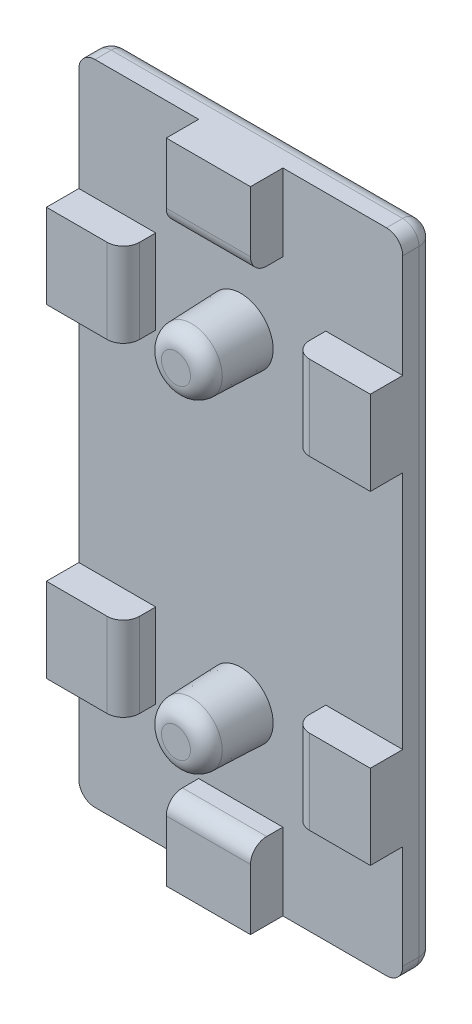
from build123d import *

# Parameters (mm, degrees)
BOSS_EXTRUDE1_DEPTH           = 2
SKETCH2_R                     = 2
BOSS_EXTRUDE2_DEPTH           = 4
BOSS_EXTRUDE2_DRAFT           = 2
BOSS_EXTRUDE2_PROFILE_2_DEPTH = 4
BOSS_EXTRUDE2_PROFILE_2_DRAFT = 2
FILLET1_R                     = 1
SKETCH4_W                     = 5.2
SKETCH4_H                     = 4.75
SKETCH4_W_2                   = 4.75
SKETCH4_H_2                   = 5.2
BOSS_EXTRUDE3_DEPTH           = 2
FILLET2_R                     = 1
CUT_EXTRUDE1_DEPTH            = 0.5


with BuildPart() as part:
    # Sketch1 → Boss-Extrude1 (new body)
    with BuildSketch(Plane.XY):
        with BuildLine():
            Line((1, 0), (19, 0))
            ThreePointArc((19, 0), (19.707106781, 0.292893219), (20, 1))
            Line((20, 1), (20, 39))
            ThreePointArc((20, 39), (19.707106781, 39.707106781), (19, 40))
            Line((19, 40), (1, 40))
            ThreePointArc((1, 40), (0.292893219, 39.707106781), (0, 39))
            Line((0, 39), (0, 1))
            ThreePointArc((0, 1), (0.292893219, 0.292893219), (1, 0))
        make_face()
    extrude(amount=BOSS_EXTRUDE1_DEPTH)


with BuildPart() as boss_extrude2_tool:
    # Sketch2 → Boss-Extrude2 (with draft: the straight prism first)
    with BuildSketch(Plane.XY.offset(2)):
        with Locations((10, 30)):
            Circle(SKETCH2_R)
    extrude(amount=BOSS_EXTRUDE2_DEPTH)
    # Boss-Extrude2: the draft: its side faces are tilted about the plane it starts from
    boss_extrude2_sides = [boss_extrude2_tool.faces().sort_by_distance(p)[0] for p in [
        (8, 30, 4),
    ]]
    draft(boss_extrude2_sides, Plane.XY.offset(2), BOSS_EXTRUDE2_DRAFT)


with BuildPart() as part_1:
    add(part.part)

    # Boss-Extrude2: add boss_extrude2_tool
    add(boss_extrude2_tool.part)


with BuildPart() as boss_extrude2_profile_2_tool:
    # Sketch2 → Boss-Extrude2 profile 2 (with draft: the straight prism first)
    with BuildSketch(Plane.XY.offset(2)):
        with Locations((10, 10)):
            Circle(SKETCH2_R)
    extrude(amount=BOSS_EXTRUDE2_PROFILE_2_DEPTH)
    # Boss-Extrude2 profile 2: the draft: its side faces are tilted about the plane it starts from
    boss_extrude2_profile_2_sides = [boss_extrude2_profile_2_tool.faces().sort_by_distance(p)[0] for p in [
        (8, 10, 4),
    ]]
    draft(boss_extrude2_profile_2_sides, Plane.XY.offset(2), BOSS_EXTRUDE2_PROFILE_2_DRAFT)


with BuildPart() as part_2:
    add(part_1.part)

    # Boss-Extrude2 profile 2: add boss_extrude2_profile_2_tool
    add(boss_extrude2_profile_2_tool.part)

    # Fillet1
    fillet1_edges = [part_2.edges().sort_by_distance(p)[0] for p in [
        (0, 20, 0),
        (0.292893219, 0.292893219, 0),
        (10, 0, 0),
        (19.707106781, 0.292893219, 0),
        (20, 20, 0),
        (19.707106781, 39.707106781, 0),
        (10, 40, 0),
        (0.292893219, 39.707106781, 0),
    ]]
    fillet(fillet1_edges, radius=FILLET1_R)

    # Sketch4 → Boss-Extrude3 (add)
    with BuildSketch(Plane.XY.offset(2)):
        with Locations((10, 37.625)):
            Rectangle(SKETCH4_W, SKETCH4_H)
        with Locations((10, 2.375)):
            Rectangle(SKETCH4_W, SKETCH4_H)
        with Locations((2.375, 30)):
            Rectangle(SKETCH4_W_2, SKETCH4_H_2)
        with Locations((2.375, 10)):
            Rectangle(SKETCH4_W_2, SKETCH4_H_2)
        with Locations((17.625, 30)):
            Rectangle(SKETCH4_W_2, SKETCH4_H_2)
        with Locations((17.625, 10)):
            Rectangle(SKETCH4_W_2, SKETCH4_H_2)
    extrude(amount=BOSS_EXTRUDE3_DEPTH)

    # Fillet2
    fillet2_edges = [part_2.edges().sort_by_distance(p)[0] for p in [
        (8.139683078, 30, 6),
        (8.139683078, 10, 6),
        (4.75, 10, 4),
        (10, 4.75, 4),
        (15.25, 10, 4),
        (15.25, 30, 4),
        (4.75, 30, 4),
        (10, 35.25, 4),
    ]]
    fillet(fillet2_edges, radius=FILLET2_R)

    # Sketch5 → Cut-Extrude1 (cut)
    with BuildSketch(Plane(origin=(0, 0, 0), x_dir=(-1, 0, 0), z_dir=(0, 0, -1))):
        Polygon((-14.786375934, 26.416896591), (-14.852212264, 26.43608174), (-14.835416922, 26.387134756), (-14.81677481, 26.339312998), (-14.796368621, 26.292573894), (-14.774281044, 26.246874873), (-14.750594771, 26.202173364), (-14.725392493, 26.158426794), (-14.6987569, 26.115592592), (-14.670770685, 26.073628187), (-14.641516537, 26.032491007), (-14.611077148, 25.99213848), (-14.579535208, 25.952528035), (-14.546973409, 25.9136171), (-14.513474442, 25.875363103), (-14.443995766, 25.800655639), (-14.334816263, 25.692457193), (-13.917511895, 25.317904382), (-14.005691589, 25.326423318), (-15.185124895, 25.515380005), (-15.229534014, 25.522117017), (-15.273534328, 25.530103191), (-15.317148794, 25.53926829), (-15.360400375, 25.54954208), (-15.445906718, 25.573134784), (-15.53023704, 25.600319416), (-15.654929288, 25.646602098), (-16.225519503, 25.897011062), (-16.390910681, 25.961270725), (-16.383415093, 25.918750858), (-16.373803927, 25.877329485), (-16.362178867, 25.836959918), (-16.348641598, 25.797595475), (-16.333293806, 25.759189469), (-16.316237175, 25.721695216), (-16.29757339, 25.685066032), (-16.277404136, 25.649255231), (-16.255831097, 25.614216129), (-16.232955959, 25.579902041), (-16.208880407, 25.546266282), (-16.183706125, 25.513262168), (-16.130468112, 25.448962133), (-16.0740554, 25.386628457), (-15.954959793, 25.266366274), (-15.686170366, 25.003596246), (-15.804835087, 25.031112715), (-16.040022293, 25.093432663), (-16.272530603, 25.164546337), (-16.616735875, 25.285284081), (-17.346903311, 25.588419154), (-17.344227417, 25.563376726), (-17.336182106, 25.514090547), (-17.324752116, 25.465856921), (-17.310185468, 25.418661031), (-17.282996808, 25.349780541), (-17.250145785, 25.283151612), (-17.18508458, 25.176971046), (-17.013866926, 24.963759201), (-16.421290053, 24.423782306), (-16.173711279, 24.244778303), (-15.864867475, 24.00967072), (-16.823521028, 24.219040589), (-17.398932887, 24.329030602), (-17.369180143, 24.276096141), (-17.337169882, 24.225486904), (-17.303015586, 24.177094787), (-17.266830734, 24.130811686), (-17.22872881, 24.086529498), (-17.188823292, 24.04414012), (-17.147227663, 24.003535447), (-17.104055403, 23.964607376), (-17.059419993, 23.927247803), (-17.013434915, 23.891348625), (-16.966213649, 23.856801738), (-16.917869676, 23.823499038), (-16.868516478, 23.791332422), (-16.818267535, 23.760193786), (-16.715536339, 23.70056804), (-16.557558484, 23.61613668), (-16.135152364, 23.399750546), (-16.034211108, 23.342961375), (-16.466508413, 23.291816812), (-16.454116059, 23.272029843), (-16.427130404, 23.234708584), (-16.397423179, 23.200233756), (-16.365250018, 23.168416787), (-16.330866554, 23.139069105), (-16.275706236, 23.099264993), (-16.196808993, 23.053075344), (-15.921704512, 22.939917238), (-15.837164175, 22.9133984), (-14.671840338, 22.649352185), (-14.910820809, 22.491962149), (-14.786205542, 22.470076345), (-14.158616766, 22.36956409), (-14.035274304, 22.340228054), (-13.953991647, 22.317017751), (-13.873617499, 22.290341045), (-13.794282138, 22.259731611), (-13.755044714, 22.242806394), (-13.71611584, 22.224723123), (-13.814668902, 22.124427835), (-13.648340365, 21.958108028), (-13.557955427, 21.897539473), (-13.500873795, 21.872092305), (-13.455010521, 21.858483596), (-13.425285668, 21.851442055), (-13.33564708, 21.834430557), (-13.184988841, 21.817224724), (-12.57772723, 21.788033232), (-12.659581211, 21.642395891), (-12.598554021, 21.618620898), (-12.474487704, 21.578304767), (-12.348148972, 21.547122766), (-12.187779816, 21.520055946), (-11.993018707, 21.503463819), (-11.732131071, 21.504904317), (-11.702848155, 21.366572637), (-11.681471553, 21.333654593), (-11.662899468, 21.318327209), (-11.647630317, 21.310406831), (-11.629774573, 21.304579431), (-11.607820379, 21.2998022), (-11.564025098, 21.293505181), (-11.520394618, 21.291226011), (-11.47694573, 21.292574203), (-11.433695226, 21.297159272), (-11.347856533, 21.314478089), (-11.015795351, 21.435131057), (-11.096989439, 21.216822079), (-10.229734651, 21.22443732), (-10.196621528, 21.221909159), (-10.163889305, 21.21804126), (-10.131544618, 21.212872501), (-10.099594102, 21.206441763), (-10.068044393, 21.198787925), (-10.036902126, 21.189949868), (-10.006173935, 21.17996647), (-9.975866458, 21.168876611), (-9.945986328, 21.156719171), (-9.916540182, 21.143533031), (-9.858976381, 21.114230165), (-9.803228137, 21.081279051), (-9.749348533, 21.044990727), (-9.697390653, 21.00567623), (-9.647407579, 20.963646598), (-9.576251848, 20.896191666), (-9.509838021, 20.824377268), (-9.448345254, 20.749253156), (-9.7849395, 20.683389745), (-9.83662758, 20.691536463), (-9.887942595, 20.701093531), (-9.938913615, 20.711950064), (-9.989569705, 20.723995181), (-10.090053371, 20.751207638), (-10.239143603, 20.798168642), (-10.780956243, 20.987884448), (-10.880663913, 21.017649231), (-10.981321027, 21.04374129), (-11.032078295, 21.055132842), (-11.083160128, 21.065273566), (-11.134595594, 21.074052579), (-11.186413759, 21.081359), (-11.238643694, 21.087081946), (-11.281876726, 21.091739987), (-11.368640316, 21.098577593), (-11.455666469, 21.102074183), (-11.542794217, 21.102186096), (-11.629862593, 21.098869675), (-11.716710629, 21.09208126), (-11.803177358, 21.081777193), (-11.889101812, 21.067913816), (-11.974323024, 21.050447469), (-12.058680026, 21.029334494), (-12.142011852, 21.004531232), (-12.224157532, 20.975994024), (-12.304956101, 20.943679211), (-12.384246591, 20.907543136), (-12.461868033, 20.867542138), (-12.650636818, 20.763312648), (-12.775014555, 20.690342014), (-12.897845415, 20.61442474), (-13.018810218, 20.535424372), (-13.137589779, 20.453204459), (-13.253864916, 20.367628548), (-13.310963581, 20.323539451), (-13.367316447, 20.278560185), (-13.422883615, 20.232673693), (-13.477625189, 20.185862919), (-13.531501269, 20.138110805), (-13.584471959, 20.089400296), (-13.63649736, 20.039714334), (-13.687537575, 19.989035864), (-13.737552705, 19.937347828), (-13.786502854, 19.88463317), (-13.834348122, 19.830874833), (-13.881048613, 19.776055762), (-13.926564429, 19.720158898), (-13.97085567, 19.663167186), (-14.013882441, 19.605063569), (-14.055604843, 19.545830991), (-14.618491972, 18.746379801), (-14.650767235, 18.695863991), (-15.153578557, 18.064851802), (-15.270315213, 17.920493502), (-15.391602566, 17.78005973), (-15.559919206, 17.598774704), (-15.735177114, 17.424119053), (-15.916719795, 17.255894172), (-16.151485985, 17.054353774), (-16.443008391, 16.824812961), (-16.609162766, 16.70935822), (-16.69335871, 16.66982675), (-16.745092456, 16.657971431), (-16.786063295, 16.655908137), (-16.805355847, 16.655227135), (-16.824454753, 16.655850532), (-16.843375412, 16.657666984), (-16.880743585, 16.664433679), (-16.917583561, 16.674636471), (-17.116267103, 16.752366744), (-17.17102211, 16.767443867), (-17.208071471, 16.773068491), (-17.226806157, 16.774218735), (-17.245701377, 16.774112476), (-17.264772532, 16.772638369), (-17.284035021, 16.769685072), (-17.303504243, 16.765141241), (-17.323195596, 16.758895532), (-17.966720976, 16.53750061), (-17.938354194, 16.416303184), (-18.389091508, 16.241458445), (-18.258335094, 16.138921453), (-18.527851634, 15.896271822), (-18.403637422, 15.807976255), (-18.429306674, 15.747569562), (-18.5059163, 15.498088645), (-18.52895454, 15.325970977), (-18.528628345, 15.194542192), (-18.340186257, 15.188312191), (-18.078502884, 14.917009038), (-18.03256369, 15.016438826), (-17.945759666, 15.199522261), (-17.914499172, 15.242954263), (-17.890517881, 15.269089252), (-17.863556704, 15.292523265), (-17.84883354, 15.303108146), (-17.83321526, 15.312874671), (-17.816651817, 15.321775138), (-17.799093163, 15.329761843), (-17.78048925, 15.336787081), (-17.740155904, 15.152741364), (-17.680429464, 15.165407309), (-17.546720396, 15.210198843), (-17.215645511, 15.40245347), (-17.05579711, 15.348661974), (-16.96742528, 15.347427134), (-16.934123638, 15.362632172), (-16.856088118, 15.408336701), (-16.5664801, 15.681077699), (-16.549336963, 15.699999961), (-16.495280289, 15.7535217), (-16.39805408, 15.833932338), (-15.983227586, 16.124404438), (-15.913391732, 16.176455879), (-15.844521012, 16.229586052), (-15.776587247, 16.283757629), (-15.709562255, 16.338933282), (-15.643417857, 16.395075681), (-15.578125873, 16.452147497), (-15.513658123, 16.510111401), (-15.449986427, 16.568930064), (-15.387082605, 16.628566157), (-15.263465863, 16.750141318), (-15.142582456, 16.874538251), (-15.024206946, 17.001458324), (-14.908113891, 17.130602905), (-14.737760764, 17.327837473), (-14.2468625, 17.935461671), (-14.215860958, 17.967815456), (-14.15596508, 18.034116039), (-14.070660623, 18.13700296), (-13.911584289, 18.351539746), (-13.548065489, 18.858458829), (-13.4620669, 18.961115344), (-13.44038156, 18.592401345), (-13.450821534, 18.506161236), (-13.464151549, 18.455339861), (-13.548006597, 18.344819631), (-14.169071838, 17.596882239), (-14.30599478, 17.410563874), (-14.32901032, 17.373966582), (-14.34949161, 17.33681622), (-14.367561677, 17.299143708), (-14.383343552, 17.260979967), (-14.396960264, 17.222355919), (-14.408534841, 17.183302484), (-14.418190313, 17.143850585), (-14.42604971, 17.104031142), (-14.432236059, 17.063875076), (-14.43687239, 17.023413308), (-14.440081733, 16.98267676), (-14.441987117, 16.941696352), (-14.442378122, 16.859127644), (-14.436260661, 16.734218664), (-14.397752545, 16.318753495), (-14.39408807, 16.237681533), (-14.467654492, 15.430165405), (-14.480961291, 15.332688053), (-14.537131403, 14.964458593), (-14.538264604, 14.890812444), (-14.535249086, 14.841800705), (-14.52868465, 14.792881531), (-14.518115186, 14.744075499), (-14.511186033, 14.719721342), (-14.504752596, 14.701934172), (-14.497405782, 14.684949056), (-14.4891944, 14.668723694), (-14.470373166, 14.638383041), (-14.448679364, 14.610573825), (-14.424503462, 14.584957657), (-14.355766976, 14.528291157), (-14.132132176, 14.374968324), (-14.071136433, 14.326712136), (-13.868158368, 14.137114828), (-13.82041572, 14.104182572), (-13.78662374, 14.085845181), (-13.750927653, 14.071023193), (-13.732276301, 14.065096934), (-13.7130418, 14.060249276), (-13.693188442, 14.056546802), (-13.672680521, 14.054056097), (-13.630687622, 14.051013631), (-12.452535971, 14.051484245), (-12.423560421, 14.054107376), (-12.328371893, 14.083604899), (-12.28045521, 14.117523105), (-12.255923773, 14.147285485), (-12.242639104, 14.17349493), (-12.23454355, 14.203124862), (-12.219185718, 14.407286635), (-12.22564453, 14.475274868), (-12.236975279, 14.524168293), (-12.248224209, 14.555296665), (-12.262806419, 14.584959847), (-12.281045228, 14.612908069), (-12.291636895, 14.626161019), (-12.303263955, 14.638891566), (-12.315966823, 14.651068489), (-12.329785915, 14.662660567), (-12.351994379, 14.68356469), (-12.374942843, 14.703309465), (-12.398593505, 14.721902586), (-12.422908564, 14.739351746), (-12.447850219, 14.755664639), (-12.473380668, 14.770848957), (-12.49946211, 14.784912393), (-12.526056744, 14.797862641), (-12.553126768, 14.809707395), (-12.580634381, 14.820454346), (-12.608541781, 14.830111189), (-12.636811168, 14.838685617), (-12.665404739, 14.846185322), (-12.694284694, 14.852617998), (-12.723413232, 14.857991339), (-12.782264847, 14.865590785), (-12.841657176, 14.869045205), (-12.901287806, 14.868416147), (-12.960854328, 14.863765154), (-13.020054329, 14.855153773), (-13.078585401, 14.842643549), (-13.136145131, 14.826296027), (-13.338883815, 15.279869848), (-13.116777254, 15.603312268), (-13.012440579, 15.789936067), (-12.952451236, 15.918976981), (-12.913449652, 16.018388874), (-12.880220293, 16.120189971), (-12.861557547, 16.189444208), (-12.776069116, 16.509422708), (-12.277642578, 16.68740958), (-12.236730466, 16.702440396), (-12.109720937, 16.735038327), (-11.810052548, 16.799339049), (-11.749350293, 16.822614846), (-11.710237499, 16.84187952), (-11.672405497, 16.864697842), (-11.628971236, 16.903214198), (-11.527791053, 17.006352957), (-11.146905201, 17.516698241), (-11.027868075, 17.47295563), (-10.90351017, 17.405950912), (-10.855392469, 17.366751026), (-10.823393836, 17.33250925), (-10.795544081, 17.293561437), (-10.779568496, 17.264734709), (-10.904271706, 16.914550764), (-11.036469517, 16.489054362), (-11.067599965, 16.343781633), (-11.084615752, 16.233179814), (-11.091607962, 16.182356821), (-11.124673091, 15.891679629), (-11.124381874, 15.812446933), (-11.120131945, 15.760425337), (-11.111993614, 15.709320396), (-11.106293858, 15.684185733), (-11.099415073, 15.659369107), (-11.091288284, 15.634900143), (-11.081844514, 15.610808465), (-11.071014788, 15.587123698), (-11.058730129, 15.563875467), (-11.044921561, 15.541093395), (-11.02952011, 15.518807107), (-11.012456797, 15.497046228), (-10.985848794, 15.465085129), (-10.902859575, 15.372326922), (-10.75582039, 15.226363053), (-10.129661164, 14.681051152), (-9.801524549, 14.269600556), (-9.660155191, 14.127932334), (-9.553095197, 14.09887306), (-9.021546991, 14.045529414), (-8.718554814, 14.04419734), (-8.592566225, 14.057493488), (-8.518794606, 14.072534515), (-8.4707368, 14.086161678), (-8.423781621, 14.103036471), (-8.378103935, 14.123474138), (-8.333878604, 14.147789918), (-8.312365218, 14.161500615), (-8.296934255, 14.191909351), (-8.279143924, 14.23957503), (-8.267419533, 14.289173513), (-8.260520201, 14.357280296), (-8.262718243, 14.426348512), (-8.280964735, 14.528660192), (-8.321043103, 14.64036946), (-8.333540269, 14.654382886), (-8.346637372, 14.667344444), (-8.360302329, 14.679305274), (-8.38920747, 14.700429294), (-8.419999025, 14.718164048), (-8.452420324, 14.732918638), (-8.521125486, 14.755123729), (-8.809802303, 14.806557819), (-8.832462412, 14.808957167), (-8.854487959, 14.812580519), (-8.875912978, 14.817362098), (-8.896771505, 14.823236127), (-8.93692522, 14.83799842), (-8.975221383, 14.856341178), (-9.029778325, 14.889417579), (-9.230716195, 15.054923756), (-9.333676338, 15.132733247), (-9.519762754, 15.263866184), (-9.557467171, 15.304644522), (-9.58026234, 15.339213495), (-9.592257671, 15.364508723), (-9.601324464, 15.391822073), (-9.607147824, 15.421341024), (-9.616309124, 15.452504527), (-9.623939111, 15.483669413), (-9.630106524, 15.514832695), (-9.634880105, 15.545991382), (-9.638328594, 15.577142487), (-9.640520733, 15.60828302), (-9.641525261, 15.639409992), (-9.641410919, 15.670520414), (-9.63810059, 15.732679652), (-9.63113967, 15.794736824), (-9.615056395, 15.887578897), (-9.502290589, 16.314722772), (-9.488323957, 16.359286779), (-9.470997534, 16.401978446), (-9.439723625, 16.463078946), (-9.363896313, 16.577951867), (-9.191408405, 16.823010954), (-9.160222242, 16.884587442), (-9.020499232, 17.188291873), (-8.960661748, 17.175222727), (-8.755913679, 17.114809173), (-8.179281464, 16.914540756), (-8.03195595, 16.867283457), (-7.885622862, 16.807651462), (-7.816155286, 16.771146154), (-7.772117135, 16.743775295), (-7.73035784, 16.713693956), (-7.69127169, 16.680659317), (-7.672854259, 16.662958628), (-7.655252972, 16.644428556), (-7.638517116, 16.625038749), (-7.622695976, 16.604758853), (-7.607838839, 16.583558517), (-7.59399499, 16.561407387), (-7.581213716, 16.538275112), (-7.569544302, 16.514131338), (-7.559955101, 16.482879891), (-7.551850332, 16.45147708), (-7.545125524, 16.419933167), (-7.539676204, 16.38825841), (-7.535397903, 16.356463072), (-7.529936466, 16.292551691), (-7.527915154, 16.196036763), (-7.540954676, 15.839710975), (-7.537656339, 15.743087371), (-7.531039499, 15.679077663), (-7.52609228, 15.647225399), (-7.519913233, 15.615488542), (-7.512397885, 15.583877352), (-7.497193243, 15.54259421), (-7.459762372, 15.463887827), (-7.244200498, 15.134938406), (-7.193092962, 15.038325511), (-7.172789572, 14.999831567), (-7.155905642, 14.960187389), (-7.130123748, 14.878218993), (-7.064088946, 14.583419077), (-7.042160822, 14.522945576), (-7.023768271, 14.483921545), (-7.001693892, 14.446155599), (-6.97412988, 14.405632487), (-6.672340973, 14.108695113), (-6.645772156, 14.090650861), (-6.618136984, 14.07614187), (-6.5749545, 14.060206473), (-6.514796293, 14.047917117), (-6.233001805, 14.043826419), (-6.207073506, 14.044850989), (-5.659119359, 14.047443972), (-5.556164289, 14.060851953), (-5.479735445, 14.077466765), (-5.456938455, 14.091929626), (-5.436093883, 14.108054931), (-5.417179592, 14.125712629), (-5.400173446, 14.144772671), (-5.38505331, 14.165105006), (-5.371797047, 14.186579584), (-5.36038252, 14.209066354), (-5.350787594, 14.232435267), (-5.342990133, 14.256556272), (-5.336968, 14.281299319), (-5.332699059, 14.306534358), (-5.330161174, 14.332131338), (-5.329332209, 14.35796021), (-5.330190027, 14.383890922), (-5.332712492, 14.409793426), (-5.336877469, 14.435537669), (-5.34266282, 14.460993603), (-5.350046411, 14.486031177), (-5.359006104, 14.510520341), (-5.369519763, 14.534331044), (-5.381565253, 14.557333236), (-5.395120437, 14.579396868), (-5.410163178, 14.600391888), (-5.426671341, 14.620188247), (-5.44462279, 14.638655894), (-5.463995388, 14.655664779), (-5.484766999, 14.671084852), (-5.506915487, 14.684786062), (-5.530418716, 14.69663836), (-5.579209828, 14.711326602), (-5.629052733, 14.722719883), (-5.937437486, 14.761178296), (-6.038316949, 14.779446627), (-6.087372148, 14.792759919), (-6.135200508, 14.809794843), (-6.158583416, 14.819927185), (-6.181574165, 14.831253056), (-6.204144273, 14.843860165), (-6.226265257, 14.857836219), (-6.247908633, 14.873268924), (-6.255725448, 14.910650942), (-6.263581668, 14.985233979), (-6.260841516, 15.077977736), (-6.181086324, 15.404103481), (-6.173515112, 15.431045166), (-6.167270995, 15.458003185), (-6.162277726, 15.484976691), (-6.158459054, 15.511964834), (-6.155738733, 15.538966766), (-6.153288144, 15.593008606), (-6.154315969, 15.647095422), (-6.161045382, 15.728295133), (-6.217294325, 16.107690254), (-6.221709324, 16.188944233), (-6.238563482, 16.859035178), (-5.943219192, 16.985086587), (-5.914435836, 16.896206825), (-5.882291807, 16.808791308), (-5.847033051, 16.722759062), (-5.788842814, 16.596127197), (-5.725027895, 16.472152216), (-5.632626521, 16.31051283), (-5.297234892, 15.806621023), (-5.061937323, 15.473564339), (-4.977413401, 15.321088423), (-4.930823319, 15.21477947), (-4.902232808, 15.132200428), (-4.886602245, 15.075659435), (-4.803728629, 14.663512644), (-4.770871666, 14.569560914), (-4.744242059, 14.515400485), (-4.420527886, 14.260875056), (-4.242891254, 14.118155761), (-4.184642094, 14.088000574), (-4.14690022, 14.076539884), (-4.120328377, 14.072338479), (-4.092489683, 14.071266625), (-3.418989386, 14.07270593), (-3.392617373, 14.074247492), (-3.366589031, 14.07804588), (-3.340995543, 14.083989488), (-3.315928088, 14.09196671), (-3.291477849, 14.10186594), (-3.267736007, 14.113575574), (-3.244793743, 14.126984005), (-3.222742238, 14.141979628), (-3.201672673, 14.158450837), (-3.18167623, 14.176286026), (-3.16284409, 14.19537359), (-3.145267434, 14.215601924), (-3.129037443, 14.236859421), (-3.114245298, 14.259034476), (-3.100982181, 14.282015484), (-3.089339274, 14.305690838), (-3.079407756, 14.329948933), (-3.07127881, 14.354678163), (-3.065043617, 14.379766924), (-3.060793357, 14.405103608), (-3.058619213, 14.430576611), (-3.058612365, 14.456074327), (-3.060863995, 14.48148515), (-3.065465283, 14.506697475), (-3.072507412, 14.531599695), (-3.082081562, 14.556080206), (-3.094278914, 14.580027402), (-3.10919065, 14.603329677), (-3.126907951, 14.625875425), (-3.144074214, 14.648005155), (-3.162261787, 14.668058359), (-3.181412041, 14.686149669), (-3.20146635, 14.702393717), (-3.222366087, 14.716905137), (-3.244052624, 14.729798561), (-3.266467335, 14.741188621), (-3.289551593, 14.75118995), (-3.313246771, 14.75991718), (-3.337494241, 14.767484945), (-3.362235377, 14.774007876), (-3.412964137, 14.784377768), (-3.676294688, 14.812512304), (-3.752725912, 14.824421988), (-3.80155594, 14.836117163), (-3.825157836, 14.843435263), (-4.283236601, 15.964258132), (-4.292991595, 15.991291213), (-4.309777718, 16.045830559), (-4.32906845, 16.128667095), (-4.352531478, 16.297013301), (-4.39480442, 16.692558951), (-4.413597286, 16.775791461), (-4.432397265, 16.866762037), (-4.466010359, 17.002057752), (-4.650292307, 17.627129826), (-4.682469044, 17.762451415), (-4.700029812, 17.853444315), (-4.713754214, 17.945209862), (-4.718983834, 17.991422514), (-4.72302163, 18.037876493), (-4.725790024, 18.084587851), (-4.421412646, 18.320036918), (-4.170637922, 18.301228057), (-4.060030836, 18.686903435), (-3.876370198, 18.590595748), (-3.753344396, 18.639579318), (-3.719465254, 18.631836181), (-3.66884925, 18.625785162), (-3.601656039, 18.626266877), (-3.266444296, 18.680829505), (-3.340747469, 18.458287943), (-2.826615244, 18.467239896), (-2.741507733, 18.172346909), (-2.432821182, 18.471009662), (-2.244751117, 18.418056538), (-2.136277636, 19.009054326), (-2.265218503, 19.382449836), (-2.287435261, 19.384893009), (-2.757845958, 19.429234213), (-2.844754091, 19.45177399), (-2.908571342, 19.475166868), (-2.909613879, 19.496722312), (-2.908991114, 19.519021547), (-2.906758026, 19.541919156), (-2.902969592, 19.565269724), (-2.89768079, 19.588927833), (-2.890946596, 19.612748069), (-2.882821989, 19.636585015), (-2.873361944, 19.660293255), (-2.862621441, 19.683727373), (-2.850655455, 19.706741953), (-2.837518965, 19.72919158), (-2.823266948, 19.750930836), (-2.807954381, 19.771814307), (-2.791636242, 19.791696576), (-2.774367507, 19.810432227), (-2.756203154, 19.827875844), (-2.737198161, 19.843882011), (-2.717407505, 19.858305312), (-2.696886163, 19.871000331), (-2.675689113, 19.881821653), (-2.653871332, 19.89062386), (-2.631487796, 19.897261537), (-2.608593485, 19.901589268), (-2.585243374, 19.903461638), (-2.561492442, 19.902733229), (-2.537395665, 19.899258626), (-2.513008021, 19.892892414), (-2.488384488, 19.883489175), (-2.463580042, 19.870903494), (-2.446046023, 19.864698256), (-2.429957731, 19.857416665), (-2.415241219, 19.849115986), (-2.40182254, 19.839853482), (-2.389627748, 19.82968642), (-2.378582895, 19.818672063), (-2.368614034, 19.806867677), (-2.359647218, 19.794330526), (-2.3516085, 19.781117875), (-2.33801957, 19.752895133), (-2.322748235, 19.706926389), (-2.285294625, 19.508640887), (-2.271856306, 19.463197624), (-2.044514092, 19.630685161), (-1.845187453, 19.797222092), (-1.78790884, 19.862477865), (-1.759727425, 19.909809275), (-1.673698852, 20.082154217), (-1.597866477, 20.289179956), (-1.524242091, 20.611347213), (-1.95111991, 20.755346771), (-2.424579316, 20.848958943), (-2.441047906, 20.850113244), (-2.456655438, 20.852512488), (-2.471440785, 20.856093516), (-2.485442825, 20.860793168), (-2.498700432, 20.866548286), (-2.511252482, 20.87329571), (-2.534395415, 20.889514842), (-2.555182627, 20.908945289), (-2.573925126, 20.931081779), (-2.598885356, 20.968255058), (-2.694629908, 21.157096994), (-2.418540985, 21.197464425), (-2.542126789, 21.436998613), (-2.324567766, 21.496873128), (-2.330675829, 21.509917529), (-2.344695833, 21.534090238), (-2.36978158, 21.56601103), (-2.409528872, 21.601739478), (-2.639338066, 21.721870036), (-2.576624856, 21.864330388), (-2.755915789, 21.954973277), (-2.907482273, 22.002806048), (-3.025595723, 22.021168375), (-3.126771149, 22.023389452), (-3.147123658, 22.030613521), (-3.206283751, 22.055926289), (-3.281271011, 22.097039828), (-3.637038112, 22.376693971), (-3.779549048, 22.187469952), (-3.828941331, 22.21184753), (-3.90465922, 22.243369489), (-3.982090194, 22.269228841), (-4.087525206, 22.295659139), (-4.249066233, 22.320173281), (-4.549178673, 22.328610908), (-4.380737592, 21.966947471), (-4.447436842, 21.964869751), (-4.535590038, 21.970622408), (-4.927581476, 22.033693502), (-5.015107615, 22.036708238), (-5.329993589, 21.864771642), (-5.404670154, 21.839128939), (-5.463214926, 21.826572458), (-5.503695658, 21.822010642), (-5.545488063, 21.820888373), (-5.729084295, 21.426368482), (-5.848151323, 21.500263803), (-6.1574886, 21.303755549), (-6.23068505, 21.279120819), (-6.273230819, 21.315668752), (-6.45339231, 21.493002056), (-6.559493519, 21.623552258), (-6.636663706, 21.740330938), (-6.689718304, 21.839204051), (-6.72382922, 21.916641945), (-7.17373156, 23.042582529), (-7.279393053, 23.34340658), (-7.335812737, 23.526366398), (-7.369834977, 23.649607689), (-7.446016333, 23.895054033), (-7.515033495, 24.092858539), (-7.553548895, 24.190563832), (-7.595373627, 24.286656881), (-7.617676552, 24.333907969), (-7.640986283, 24.380526981), (-7.665362642, 24.42643758), (-7.690865454, 24.471563428), (-7.717554542, 24.515828187), (-7.745489731, 24.559155519), (-7.774730844, 24.601469085), (-7.805337705, 24.642692548), (-7.837370138, 24.68274957), (-7.870887967, 24.721563813), (-7.905951015, 24.759058938), (-7.942619107, 24.795158609), (-7.980952066, 24.829786486), (-8.021009717, 24.862866231), (-8.062851883, 24.894321508), (-8.106538388, 24.924075977), (-8.155524677, 24.944768322), (-8.204912019, 24.963632107), (-8.254678537, 24.980759886), (-8.304802351, 24.996244211), (-8.355261582, 25.010177633), (-8.406034353, 25.022652705), (-8.457098784, 25.03376198), (-8.508432996, 25.043598009), (-8.560015111, 25.052253346), (-8.61182325, 25.059820541), (-8.716030086, 25.072060719), (-8.820878473, 25.081058961), (-9.401190695, 25.105687135), (-9.610023769, 25.119945049), (-10.81576137, 25.279278565), (-12.450281794, 25.598279138), (-12.557015195, 25.614697427), (-12.662932652, 25.634468398), (-12.820425695, 25.669741588), (-13.028186751, 25.725650165), (-13.945414107, 26.039665555), (-14.041263269, 26.076263836), (-14.471942221, 26.285210147), (-14.689846734, 26.382740791), align=None)
    extrude(amount=-CUT_EXTRUDE1_DEPTH, mode=Mode.SUBTRACT)


solid = part_2.part
